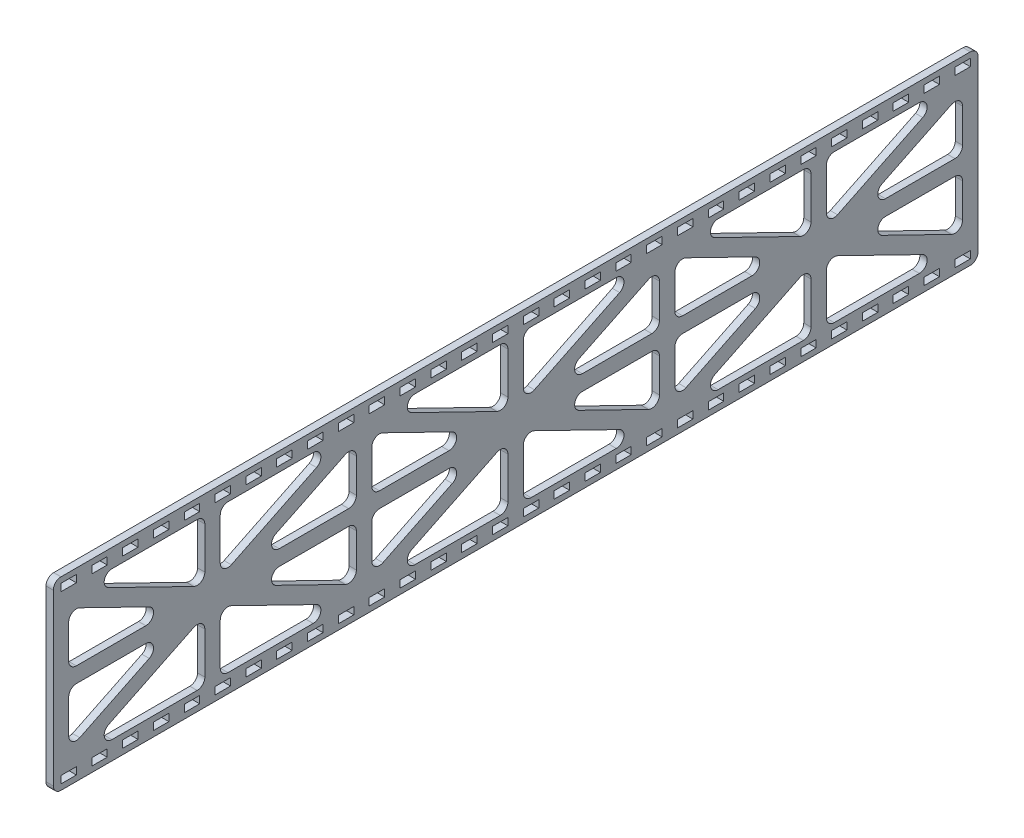
from build123d import *

# Parameters (mm, degrees)
SKETCH1_W          = 381
SKETCH1_H          = 76.2
OUTER_CUT_DEPTH    = 1.4986
CUT_EXTRUDE1_DEPTH = 195.295762197
FILLET1_R          = 3.175
SKETCH2_W          = 6.35
SKETCH2_H          = 3
SLOT_DEPTH         = 195.295762197
SLOTS_COUNT        = 16
SLOTS_PITCH        = 12.7
SLOTS_COUNT_DIR2   = 16
SLOTS_PITCH_DIR2   = 12.7


# Read off the part's stored shape, not the designer's step: Mirror1
with BuildPart() as part:
    # Sketch1 → Outer Cut (new, symmetric)
    with BuildSketch(Plane(origin=(0, 0, 0), x_dir=(0, 0, -1), z_dir=(1, 0, 0))):
        Rectangle(SKETCH1_W, SKETCH1_H)
    extrude(amount=OUTER_CUT_DEPTH, both=True)

    # Sketch3 → Cut-Extrude1 (cut, through all)
    with BuildSketch(Plane(origin=(1.4986, 0, 0), x_dir=(0, 0, -1), z_dir=(1, 0, 0))):
        Polygon((-184.15, 25.39709723), (-184.15, 3.175), (-138.625564702, 3.175), align=None)
        Polygon((-138.625564702, -3.175), (-184.15, -3.175), (-184.15, -25.39709723), align=None)
        Polygon((-128.058333333, 30.48), (-180.087108909, 30.48), (-128.058333333, 5.08290277), align=None)
        Polygon((-128.058333333, -5.08290277), (-180.087108909, -30.48), (-128.058333333, -30.48), align=None)
        Polygon((-121.708333333, -5.08290277), (-121.708333333, -30.48), (-69.679557758, -30.48), align=None)
        Polygon((-65.616666667, -3.175), (-111.141101964, -3.175), (-65.616666667, -25.39709723), align=None)
        Polygon((-65.616666667, 3.175), (-65.616666667, 25.39709723), (-111.141101964, 3.175), align=None)
        Polygon((-69.679557758, 30.48), (-121.708333333, 30.48), (-121.708333333, 5.08290277), align=None)
        Polygon((-13.742231369, 3.175), (-59.266666667, 25.39709723), (-59.266666667, 3.175), align=None)
        Polygon((-3.175, 30.48), (-55.203775575, 30.48), (-3.175, 5.08290277), align=None)
        Polygon((-13.742231369, -3.175), (-59.266666667, -3.175), (-59.266666667, -25.39709723), align=None)
        Polygon((-3.175, -5.08290277), (-55.203775575, -30.48), (-3.175, -30.48), align=None)
        Polygon((3.175, -5.08290277), (3.175, -30.48), (55.203775575, -30.48), align=None)
        Polygon((59.266666667, -25.39709723), (59.266666667, -3.175), (13.742231369, -3.175), align=None)
        Polygon((59.266666667, 3.175), (59.266666667, 25.39709723), (13.742231369, 3.175), align=None)
        Polygon((55.203775575, 30.48), (3.175, 30.48), (3.175, 5.08290277), align=None)
        Polygon((69.679557758, -30.48), (121.708333333, -30.48), (121.708333333, -5.08290277), align=None)
        Polygon((111.141101964, -3.175), (65.616666667, -3.175), (65.616666667, -25.39709723), align=None)
        Polygon((111.141101964, 3.175), (65.616666667, 25.39709723), (65.616666667, 3.175), align=None)
        Polygon((121.708333333, 5.08290277), (121.708333333, 30.48), (69.679557758, 30.48), align=None)
        Polygon((128.058333333, 5.08290277), (180.087108909, 30.48), (128.058333333, 30.48), align=None)
        Polygon((184.15, 3.175), (184.15, 25.39709723), (138.625564702, 3.175), align=None)
        Polygon((184.15, -25.39709723), (184.15, -3.175), (138.625564702, -3.175), align=None)
        Polygon((128.058333333, -30.48), (180.087108909, -30.48), (128.058333333, -5.08290277), align=None)
    extrude(amount=-CUT_EXTRUDE1_DEPTH, mode=Mode.SUBTRACT)

    # Fillet1
    fillet1_edges = [part.edges().sort_by_distance(p)[0] for p in [
        (0, -30.48, 55.203775575),
        (0, -5.08290277, 3.175),
        (0, -30.48, 3.175),
        (0, -3.175, 59.266666667),
        (0, -3.175, 13.742231369),
        (0, -25.39709723, 59.266666667),
        (0, 5.08290277, 3.175),
        (0, 30.48, 55.203775575),
        (0, 30.48, 3.175),
        (0, -5.08290277, -121.708333333),
        (0, -30.48, -121.708333333),
        (0, -30.48, -69.679557758),
        (0, 5.08290277, -3.175),
        (0, 30.48, -3.175),
        (0, 30.48, -55.203775575),
        (0, 25.39709723, -59.266666667),
        (0, 3.175, -59.266666667),
        (0, 3.175, -13.742231369),
        (0, -3.175, -59.266666667),
        (0, -25.39709723, -59.266666667),
        (0, -3.175, -13.742231369),
        (0, -5.08290277, 121.708333333),
        (0, -30.48, 69.679557758),
        (0, -30.48, 121.708333333),
        (0, -30.48, 128.058333333),
        (0, -30.48, 180.087108909),
        (0, -5.08290277, 128.058333333),
        (0, 5.08290277, 128.058333333),
        (0, 30.48, 180.087108909),
        (0, 30.48, 128.058333333),
        (0, -3.175, 138.625564702),
        (0, -25.39709723, 184.15),
        (0, -3.175, 184.15),
        (0, 25.39709723, 59.266666667),
        (0, 3.175, 13.742231369),
        (0, 3.175, 59.266666667),
        (0, 5.08290277, 121.708333333),
        (0, 30.48, 121.708333333),
        (0, 30.48, 69.679557758),
        (0, 25.39709723, 65.616666667),
        (0, 3.175, 65.616666667),
        (0, 3.175, 111.141101964),
        (0, -3.175, 65.616666667),
        (0, -25.39709723, 65.616666667),
        (0, -3.175, 111.141101964),
        (0, 3.175, -138.625564702),
        (0, 25.39709723, -184.15),
        (0, 3.175, -184.15),
        (0, -3.175, -138.625564702),
        (0, -3.175, -184.15),
        (0, -25.39709723, -184.15),
        (0, -5.08290277, -128.058333333),
        (0, -30.48, -180.087108909),
        (0, -30.48, -128.058333333),
        (0, -3.175, -65.616666667),
        (0, -3.175, -111.141101964),
        (0, -25.39709723, -65.616666667),
        (0, 25.39709723, -65.616666667),
        (0, 3.175, -111.141101964),
        (0, 3.175, -65.616666667),
        (0, 30.48, -121.708333333),
        (0, 5.08290277, -121.708333333),
        (0, 30.48, -69.679557758),
        (0, 5.08290277, -128.058333333),
        (0, 30.48, -128.058333333),
        (0, 30.48, -180.087108909),
        (0, 25.39709723, 184.15),
        (0, 3.175, 138.625564702),
        (0, 3.175, 184.15),
        (0, 38.1, 190.5),
        (0, 38.1, -190.5),
        (0, -38.1, -190.5),
        (0, -38.1, 190.5),
        (0, -5.08290277, -3.175),
        (0, -30.48, -55.203775575),
        (0, -30.48, -3.175),
    ]]
    fillet(fillet1_edges, radius=FILLET1_R)

    # Sketch2 → Slot (cut, through all)
    with BuildSketch(Plane(origin=(1.4986, 0, 0), x_dir=(0, 0, -1), z_dir=(1, 0, 0))):
        with Locations((6.35, 34.29)):
            Rectangle(SKETCH2_W, SKETCH2_H)
    slot = extrude(amount=-SLOT_DEPTH, mode=Mode.SUBTRACT)

    # Slots: Slot 16 × 16
    with Locations(*[Vector(0, 0, 1) * (i * SLOTS_PITCH) + Vector(0, 0, -1) * (j * SLOTS_PITCH_DIR2) for i in range(SLOTS_COUNT) for j in range(SLOTS_COUNT_DIR2) if (i, j) != (0, 0)]):
        add(slot, mode=Mode.SUBTRACT)

    # Mirror1
    split(bisect_by=Plane.ZX, keep=Keep.TOP)

    # Mirror1 2: part across plane


with BuildPart() as part_1:
    add(part.part)
    add(part.part.mirror(Plane.ZX))


solid = part_1.part
